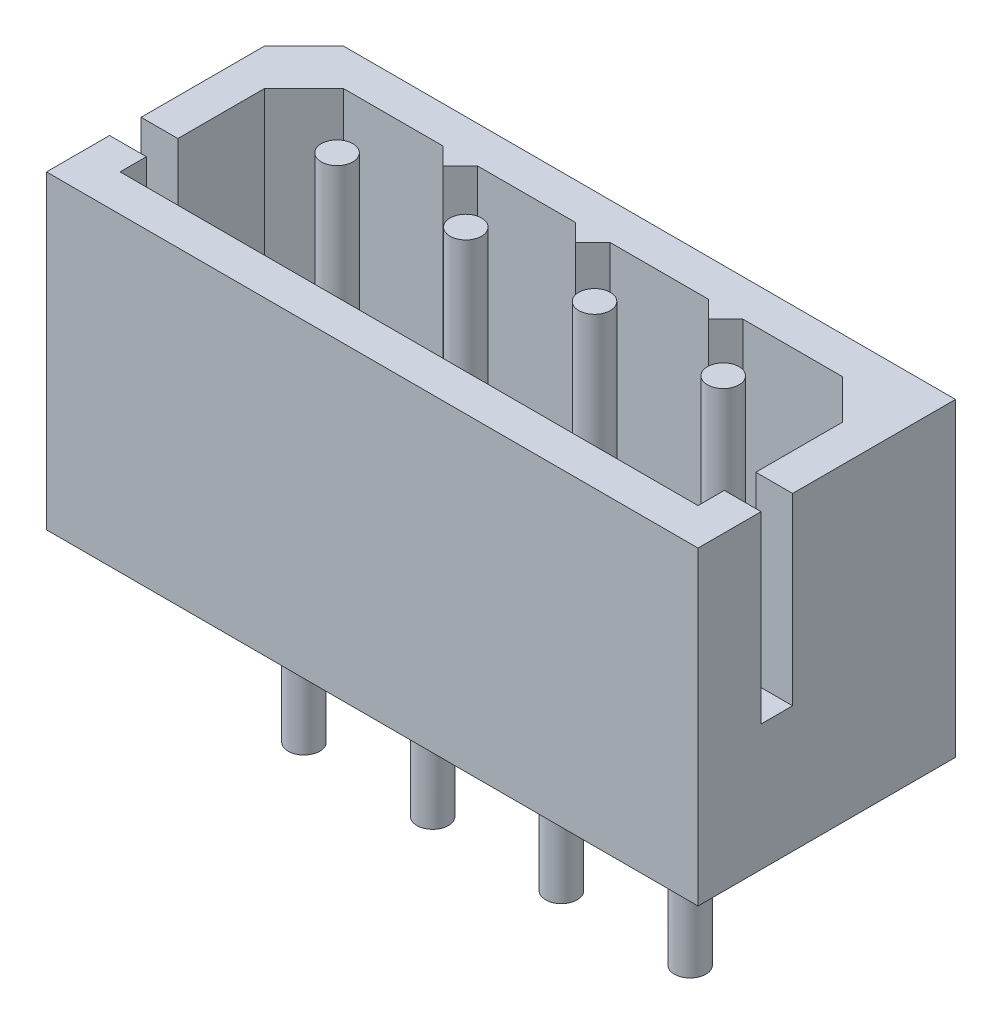
from build123d import *

# Parameters (mm, degrees)
BOSS_EXTRUDE1_DEPTH = 5.9
SKETCH2_R           = 0.3
BOSS_EXTRUDE2_DEPTH = 3.5
SKETCH3_R           = 0.3
CUT_EXTRUDE1_DEPTH  = 3.5


with BuildPart() as part:
    # Sketch1 → Boss-Extrude1 (new body)
    with BuildSketch(Plane(origin=(0, 0, 0), x_dir=(1, 0, 0), z_dir=(0, 1, 0))):
        Polygon((-5.45, 2.45), (-6.2, 1.7), (-6.2, -2.45), (6.2, -2.45), (6.2, 2.45), align=None)
    extrude(amount=-BOSS_EXTRUDE1_DEPTH)

    # Sketch2 → Boss-Extrude2 (add)
    with BuildSketch(Plane.XZ.offset(5.9)):
        with Locations((-3.75, 0)):
            Circle(SKETCH2_R)
        with Locations((-1.3, 0)):
            Circle(SKETCH2_R)
        with Locations((1.15, 0)):
            Circle(SKETCH2_R)
        with Locations((3.6, 0)):
            Circle(SKETCH2_R)
    extrude(amount=BOSS_EXTRUDE2_DEPTH)

    # Sketch3 → Cut-Extrude1 (cut)
    with BuildSketch(Plane(origin=(0, 0, 0), x_dir=(1, 0, 0), z_dir=(0, 1, 0))):
        Polygon((-2.853247496, 1.75), (-4.75, 1.75), (-5.5, 1), (-5.5, -0.65), (-6.2, -0.65), (-6.2, -1.25), (-5.5, -1.25), (-5.5, -1.75), (5.5, -1.75), (5.5, -1.25), (6.2, -1.25), (6.2, -0.65), (5.5, -0.65), (5.5, 1), (4.75, 1.75), (2.853247496, 1.75), (2.525, 1.421752504), (2.196752504, 1.75), (0.328247496, 1.75), (0, 1.421752504), (-0.328247496, 1.75), (-2.196752504, 1.75), (-2.525, 1.421752504), align=None)
        with Locations((-3.75, 0.63)):
            Circle(SKETCH3_R, mode=Mode.SUBTRACT)
        with Locations((-1.3, 0.63)):
            Circle(SKETCH3_R, mode=Mode.SUBTRACT)
        with Locations((1.15, 0.63)):
            Circle(SKETCH3_R, mode=Mode.SUBTRACT)
        with Locations((3.6, 0.63)):
            Circle(SKETCH3_R, mode=Mode.SUBTRACT)
    extrude(amount=-CUT_EXTRUDE1_DEPTH, mode=Mode.SUBTRACT)


solid = part.part
